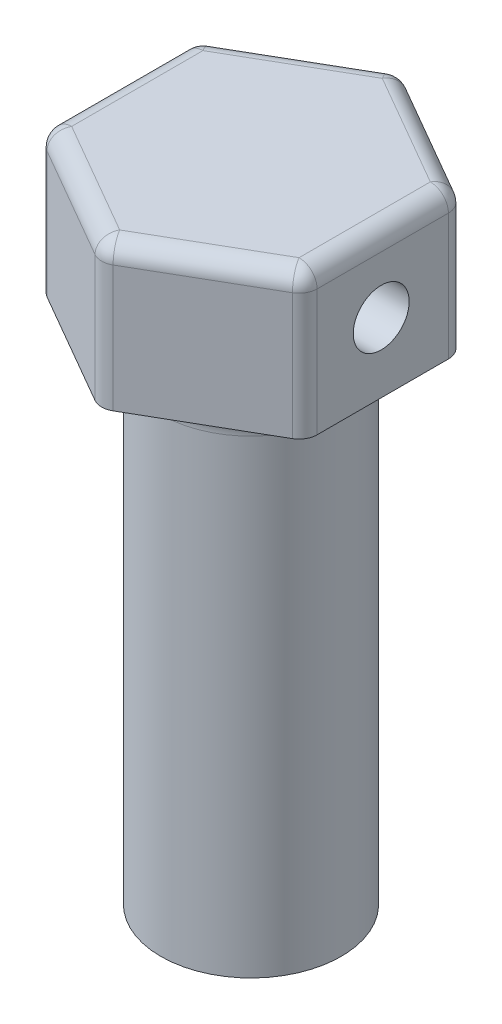
from build123d import *

# Parameters (mm, degrees)
BOSS_EXTRUDE1_DEPTH = 8
SKETCH2_R           = 5
BOSS_EXTRUDE2_DEPTH = 28
FILLET1_R           = 2
SKETCH3_R           = 1.55
CUT_EXTRUDE1_DEPTH  = 33.683533061
FILLET2_R           = 1
CUT_EXTRUDE3_START  = -4
SKETCH5_R           = 1.55
CUT_EXTRUDE3_DEPTH  = 4


with BuildPart() as part:
    # Sketch1 → Boss-Extrude1 (new body)
    with BuildSketch(Plane(origin=(0, 0, 0), x_dir=(1, 0, 0), z_dir=(0, 1, 0))):
        Polygon((7.3, -4.214656965), (7.3, 4.214656965), (0, 8.42931393), (-7.3, 4.214656965), (-7.3, -4.214656965), (0, -8.42931393), align=None)
    extrude(amount=BOSS_EXTRUDE1_DEPTH)

    # Sketch2 → Boss-Extrude2 (add)
    with BuildSketch(Plane.XZ):
        Circle(SKETCH2_R)
        with BuildLine():
            Line((-1.15, 1.039230485), (-1.15, -1.039230485))
            ThreePointArc((-1.15, -1.039230485), (1.55, 0), (-1.15, 1.039230485))
        make_face(mode=Mode.SUBTRACT)
    extrude(amount=BOSS_EXTRUDE2_DEPTH)

    # Fillet1
    fillet1_edges = [part.edges().sort_by_distance(p)[0] for p in [
        (-5, 0, 0),
    ]]
    fillet(fillet1_edges, radius=FILLET1_R)

    # Sketch3 → Cut-Extrude1 (cut, through all)
    with BuildSketch(Plane(origin=(7.3, 0, 0), x_dir=(0, 0, -1), z_dir=(1, 0, 0))):
        with Locations((-0.085343035, 3.85)):
            Circle(SKETCH3_R)
    extrude(amount=-CUT_EXTRUDE1_DEPTH, mode=Mode.SUBTRACT)

    # Fillet2
    fillet2_edges = [part.edges().sort_by_distance(p)[0] for p in [
        (-3.65, 8, 6.321985448),
        (-7.3, 8, 0),
        (-3.65, 8, -6.321985448),
        (3.65, 8, -6.321985448),
        (7.3, 8, 0),
        (3.65, 8, 6.321985448),
        (-7.3, 4, -4.214656965),
        (0, 4, -8.42931393),
        (7.3, 4, -4.214656965),
        (7.3, 4, 4.214656965),
        (0, 4, 8.42931393),
        (-7.3, 4, 4.214656965),
    ]]
    fillet(fillet2_edges, radius=FILLET2_R)

    # Sketch5 → Cut-Extrude3 (cut)
    with BuildSketch(Plane.XZ.offset(28).offset(CUT_EXTRUDE3_START)):
        Circle(SKETCH5_R)
    extrude(amount=CUT_EXTRUDE3_DEPTH, mode=Mode.SUBTRACT)


solid = part.part
